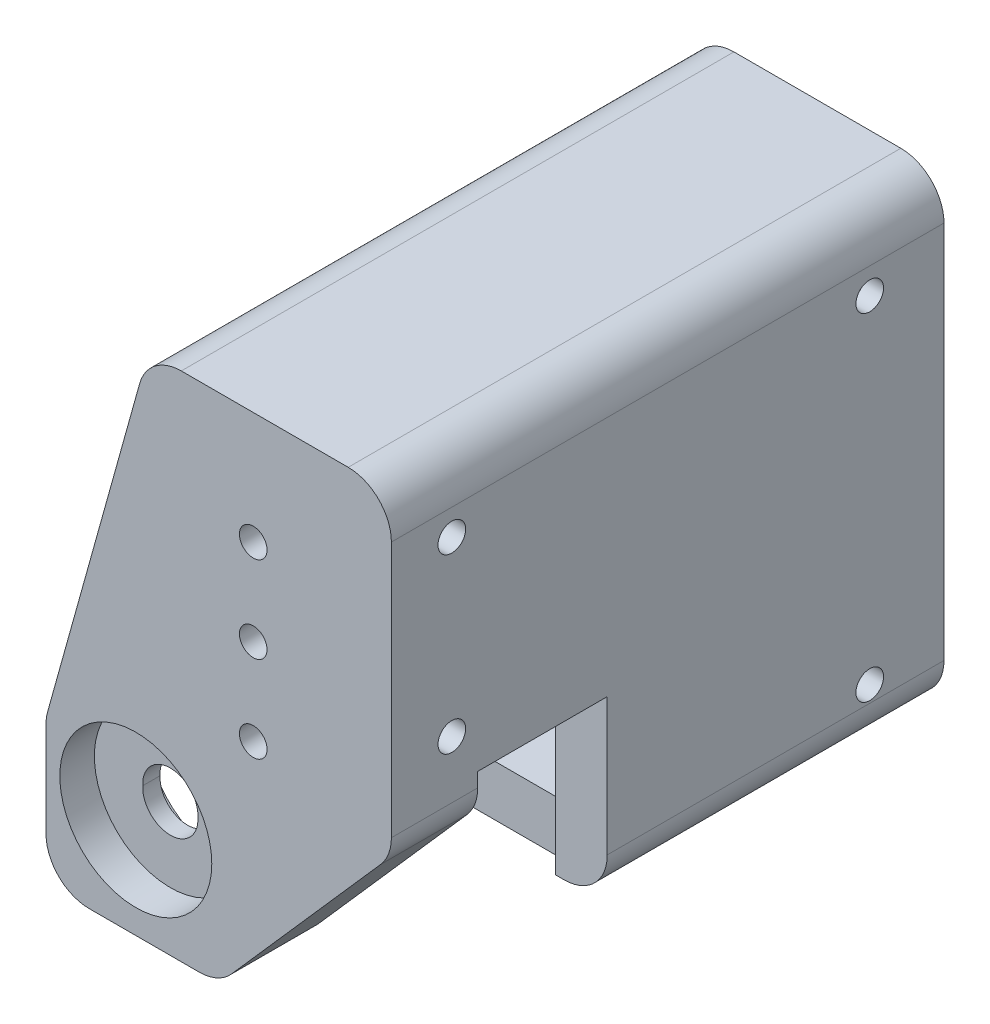
from build123d import *

# Parameters (mm, degrees)
SKETCH1_W            = 50.8
SKETCH1_H            = 76.2
BOSS_EXTRUDE1_DEPTH  = 12.7
SKETCH3_R            = 2.032
CUT_EXTRUDE1_DEPTH   = 12.7
SKETCH17_W           = 7.62
SKETCH17_H           = 76.2
BOSS_EXTRUDE13_DEPTH = 68.58
SKETCH18_W           = 3.81
SKETCH18_H           = 19.05
BOSS_EXTRUDE14_DEPTH = 43.18
SKETCH19_W           = 29.21
SKETCH19_H           = 19.05
BOSS_EXTRUDE15_DEPTH = 43.18
SKETCH4_R            = 4.064
CUT_EXTRUDE5_DEPTH   = 125.729995039
CUT_EXTRUDE6_START   = -5.08
SKETCH21_R           = 11.176
SKETCH21_R_2         = 4.064
CUT_EXTRUDE6_DEPTH   = 5.08
SKETCH22_R           = 11.176
SKETCH22_R_2         = 4.064
CUT_EXTRUDE7_DEPTH   = 5.08
SKETCH23_W           = 19.05
SKETCH23_H           = 38.1
CUT_EXTRUDE8_DEPTH   = 115.424594585
SKETCH26_W           = 17.78
SKETCH26_H           = 46.99
BOSS_EXTRUDE16_DEPTH = 57.15
SKETCH28_W           = 50.8
SKETCH28_H           = 81.28
BOSS_EXTRUDE18_DEPTH = 3.81
SKETCH35_R           = 4.064
CUT_EXTRUDE10_DEPTH  = 125.729995039
SKETCH32_R           = 2.032
CUT_EXTRUDE12_DEPTH  = 9.525
SKETCH41_R           = 2.032
CUT_EXTRUDE14_DEPTH  = 9.525
SKETCH43_R           = 3.96875
CUT_EXTRUDE15_DEPTH  = 4.7625
SKETCH46_R           = 3.937
CUT_EXTRUDE17_DEPTH  = 3.048
SKETCH48_R           = 2.54
CUT_EXTRUDE18_DEPTH  = 25.908
SKETCH49_W           = 50.8
SKETCH49_H           = 4.744734857
CUT_EXTRUDE19_DEPTH  = 92.202
CUT_EXTRUDE20_DEPTH  = 92.202
SKETCH52_W           = 50.8
SKETCH52_H           = 6.844747076
CUT_EXTRUDE21_DEPTH  = 62.484
CUT_EXTRUDE22_DEPTH  = 23.876
FILLET1_R            = 6.35
FILLET2_R            = 6.35
FILLET3_R            = 6.35
FILLET4_R            = 6.35
FILLET5_R            = 6.35
FILLET6_R            = 6.35
FILLET7_R            = 6.35
FILLET8_R            = 6.35


with BuildPart() as part:
    # Sketch1 → Boss-Extrude1 (new body)
    with BuildSketch(Plane.XY):
        with Locations((23.853164533, -42.679075546)):
            Rectangle(SKETCH1_W, SKETCH1_H)
    extrude(amount=BOSS_EXTRUDE1_DEPTH)

    # Sketch3 → Cut-Extrude1 (cut)
    with BuildSketch(Plane.XY.offset(12.7)):
        with Locations((28.933164533, -42.679075546)):
            Circle(SKETCH3_R)
        with Locations((28.933164533, -29.979075546)):
            Circle(SKETCH3_R)
        with Locations((28.933164533, -17.279075546)):
            Circle(SKETCH3_R)
    extrude(amount=-CUT_EXTRUDE1_DEPTH, mode=Mode.SUBTRACT)

    # Sketch17 → Boss-Extrude13 (add)
    with BuildSketch(Plane(origin=(0, 0, 0), x_dir=(-1, 0, 0), z_dir=(0, 0, -1))):
        with Locations((-45.443164533, -42.679075546)):
            Rectangle(SKETCH17_W, SKETCH17_H)
    extrude(amount=BOSS_EXTRUDE13_DEPTH)

    # Sketch18 → Boss-Extrude14 (add)
    with BuildSketch(Plane.ZY.offset(-41.633164533)):
        with Locations((-66.675, -71.254075546)):
            Rectangle(SKETCH18_W, SKETCH18_H)
    extrude(amount=BOSS_EXTRUDE14_DEPTH)

    # Sketch19 → Boss-Extrude15 (add)
    with BuildSketch(Plane.ZY.offset(-41.633164533)):
        with Locations((-36.195, -71.254075546)):
            Rectangle(SKETCH19_W, SKETCH19_H)
    extrude(amount=BOSS_EXTRUDE15_DEPTH)

    # Sketch4 → Cut-Extrude5 (cut, through all)
    with BuildSketch(Plane.XY.offset(12.7)):
        with Locations((11.661164533, -61.30266317)):
            Circle(SKETCH4_R)
    extrude(amount=-CUT_EXTRUDE5_DEPTH, mode=Mode.SUBTRACT)

    # Sketch21 → Cut-Extrude6 (cut)
    with BuildSketch(Plane(origin=(0, 0, 0), x_dir=(-1, 0, 0), z_dir=(0, 0, -1)).offset(CUT_EXTRUDE6_START)):
        with Locations((-11.661164533, -61.30266317)):
            Circle(SKETCH21_R)
        with Locations(Location((-11.661164533, -61.30266317, 0), (0, 0, 180))):
            Circle(SKETCH21_R_2, mode=Mode.SUBTRACT)
    extrude(amount=CUT_EXTRUDE6_DEPTH, mode=Mode.SUBTRACT)

    # Sketch22 → Cut-Extrude7 (cut)
    with BuildSketch(Plane.XY.offset(12.7)):
        with Locations(Location((11.661164533, -61.30266317, 0), (0, 0, 180))):
            Circle(SKETCH22_R)
        with Locations((11.661164533, -61.30266317)):
            Circle(SKETCH22_R_2, mode=Mode.SUBTRACT)
    extrude(amount=-CUT_EXTRUDE7_DEPTH, mode=Mode.SUBTRACT)

    # Sketch23 → Cut-Extrude8 (cut, through all)
    with BuildSketch(Plane.ZY.offset(-41.633164533)):
        with Locations((-9.525, -61.729075546)):
            Rectangle(SKETCH23_W, SKETCH23_H)
    extrude(amount=-CUT_EXTRUDE8_DEPTH, mode=Mode.SUBTRACT)

    # Sketch26 → Boss-Extrude16 (add)
    with BuildSketch(Plane(origin=(0, -61.729075546, 0), x_dir=(1, 0, 0), z_dir=(0, 1, 0))):
        with Locations((7.343164533, 45.085)):
            Rectangle(SKETCH26_W, SKETCH26_H)
    extrude(amount=BOSS_EXTRUDE16_DEPTH)

    # Sketch28 → Boss-Extrude18 (add)
    with BuildSketch(Plane(origin=(0, -4.579075546, 0), x_dir=(1, 0, 0), z_dir=(0, 1, 0))):
        with Locations((23.853164533, 27.94)):
            Rectangle(SKETCH28_W, SKETCH28_H)
    extrude(amount=BOSS_EXTRUDE18_DEPTH)

    # Sketch35 → Cut-Extrude10 (cut, through all)
    with BuildSketch(Plane.XY.offset(12.7)):
        with Locations((11.661164533, -61.729075546)):
            Circle(SKETCH35_R)
    extrude(amount=-CUT_EXTRUDE10_DEPTH, mode=Mode.SUBTRACT)

    # Sketch32 → Cut-Extrude12 (cut)
    with BuildSketch(Plane(origin=(49.253164533, 0, 0), x_dir=(0, 0, -1), z_dir=(1, 0, 0))):
        with Locations(Location((-3.81, -36.329075546, 0), (0, 0, 90))):
            Circle(SKETCH32_R)
        with Locations(Location((-3.81, -10.929075546, 0), (0, 0, 90))):
            Circle(SKETCH32_R)
    extrude(amount=-CUT_EXTRUDE12_DEPTH, mode=Mode.SUBTRACT)

    # Sketch41 → Cut-Extrude14 (cut)
    with BuildSketch(Plane.ZY.offset(-41.633164533)):
        with Locations(Location((-57.658, -10.929075546, 0), (0, 0, 270))):
            Circle(SKETCH41_R)
        with Locations(Location((-57.658, -60.459075546, 0), (0, 0, 270))):
            Circle(SKETCH41_R)
    extrude(amount=-CUT_EXTRUDE14_DEPTH, mode=Mode.SUBTRACT)

    # Sketch43 → Cut-Extrude15 (cut)
    with BuildSketch(Plane.ZY.offset(-41.633164533)):
        with Locations(Location((-57.658, -10.929075546, 0), (0, 0, 270))):
            Circle(SKETCH43_R)
        with Locations(Location((-57.658, -60.459075546, 0), (0, 0, 270))):
            Circle(SKETCH43_R)
    extrude(amount=-CUT_EXTRUDE15_DEPTH, mode=Mode.SUBTRACT)

    # Sketch46 → Cut-Extrude17 (cut)
    with BuildSketch(Plane(origin=(0, 0, 0), x_dir=(-1, 0, 0), z_dir=(0, 0, -1))):
        with Locations((-28.933164533, -42.679075546)):
            Circle(SKETCH46_R)
    extrude(amount=-CUT_EXTRUDE17_DEPTH, mode=Mode.SUBTRACT)

    # Sketch48 → Cut-Extrude18 (cut)
    with BuildSketch(Plane.ZY.offset(1.546835467)):
        with Locations(Location((-57.658, -10.929075546, 0), (0, 0, 270))):
            Circle(SKETCH48_R)
    extrude(amount=-CUT_EXTRUDE18_DEPTH, mode=Mode.SUBTRACT)

    # Sketch49 → Cut-Extrude19 (cut)
    with BuildSketch(Plane.XY.offset(12.7)):
        with Locations((23.853164533, -78.406708118)):
            Rectangle(SKETCH49_W, SKETCH49_H)
    extrude(amount=-CUT_EXTRUDE19_DEPTH, mode=Mode.SUBTRACT)

    # Sketch51 → Cut-Extrude20 (cut)
    with BuildSketch(Plane.XY.offset(12.7)):
        Polygon((13.530749107, -0.769075546), (-1.546835467, -54.869608678), (-1.546835467, -0.769075546), align=None)
    extrude(amount=-CUT_EXTRUDE20_DEPTH, mode=Mode.SUBTRACT)

    # Sketch52 → Cut-Extrude21 (cut)
    with BuildSketch(Plane(origin=(0, 0, -68.58), x_dir=(-1, 0, 0), z_dir=(0, 0, -1))):
        with Locations((-23.853164533, -72.611967151)):
            Rectangle(SKETCH52_W, SKETCH52_H)
    extrude(amount=-CUT_EXTRUDE21_DEPTH, mode=Mode.SUBTRACT)

    # Sketch53 → Cut-Extrude22 (cut)
    with BuildSketch(Plane.XY.offset(12.7)):
        Polygon((23.853164533, -76.034340689), (49.253164533, -47.175169833), (49.253164533, -76.034340689), align=None)
    extrude(amount=-CUT_EXTRUDE22_DEPTH, mode=Mode.SUBTRACT)

    # Fillet1
    fillet1_edges = [part.edges().sort_by_distance(p)[0] for p in [
        (-1.546835467, -54.869608678, -45.085),
    ]]
    fillet(fillet1_edges, radius=FILLET1_R)

    # Fillet2
    # the kernel refuses this fillet: 6.35 mm, written as the material it takes off along each edge
    with BuildSketch(Plane(origin=(13.530749107, -0.769075546, 24.755694059), x_dir=(-0.26846462888250333, -0.9632895426812126, 0), z_dir=(0, 0, -1))) as fillet2_piece_1:
        with BuildLine():
            CenterArc((FILLET2_R * 0.759413798972, -FILLET2_R), FILLET2_R, 90, 74.427076266)
            Line((-FILLET2_R * 0.203875743709, -FILLET2_R * 0.731535371117), (0, 0))
            Line((0, 0), (FILLET2_R * 0.759413798972, 0))
        make_face()
    extrude(amount=105.391388117, mode=Mode.SUBTRACT)

    # Fillet3
    fillet3_edges = [part.edges().sort_by_distance(p)[0] for p in [
        (-1.546835467, -54.869608678, 6.35),
    ]]
    fillet(fillet3_edges, radius=FILLET3_R)

    # Fillet4
    fillet4_edges = [part.edges().sort_by_distance(p)[0] for p in [
        (49.253164533, -0.769075546, -27.94),
    ]]
    fillet(fillet4_edges, radius=FILLET4_R)

    # Fillet5
    fillet5_edges = [part.edges().sort_by_distance(p)[0] for p in [
        (49.253164533, -47.175169833, 6.35),
    ]]
    fillet(fillet5_edges, radius=FILLET5_R)

    # Fillet6
    fillet6_edges = [part.edges().sort_by_distance(p)[0] for p in [
        (-1.546835467, -76.034340689, 6.35),
        (23.853164533, -76.034340689, 6.35),
    ]]
    fillet(fillet6_edges, radius=FILLET6_R)

    # Fillet7
    fillet7_edges = [part.edges().sort_by_distance(p)[0] for p in [
        (-1.546835467, -69.189593613, -66.675),
        (-1.546835467, -69.189593613, -36.195),
    ]]
    fillet(fillet7_edges, radius=FILLET7_R)

    # Fillet8
    fillet8_edges = [part.edges().sort_by_distance(p)[0] for p in [
        (49.253164533, -69.189593613, -43.815),
    ]]
    fillet(fillet8_edges, radius=FILLET8_R)


solid = part.part
